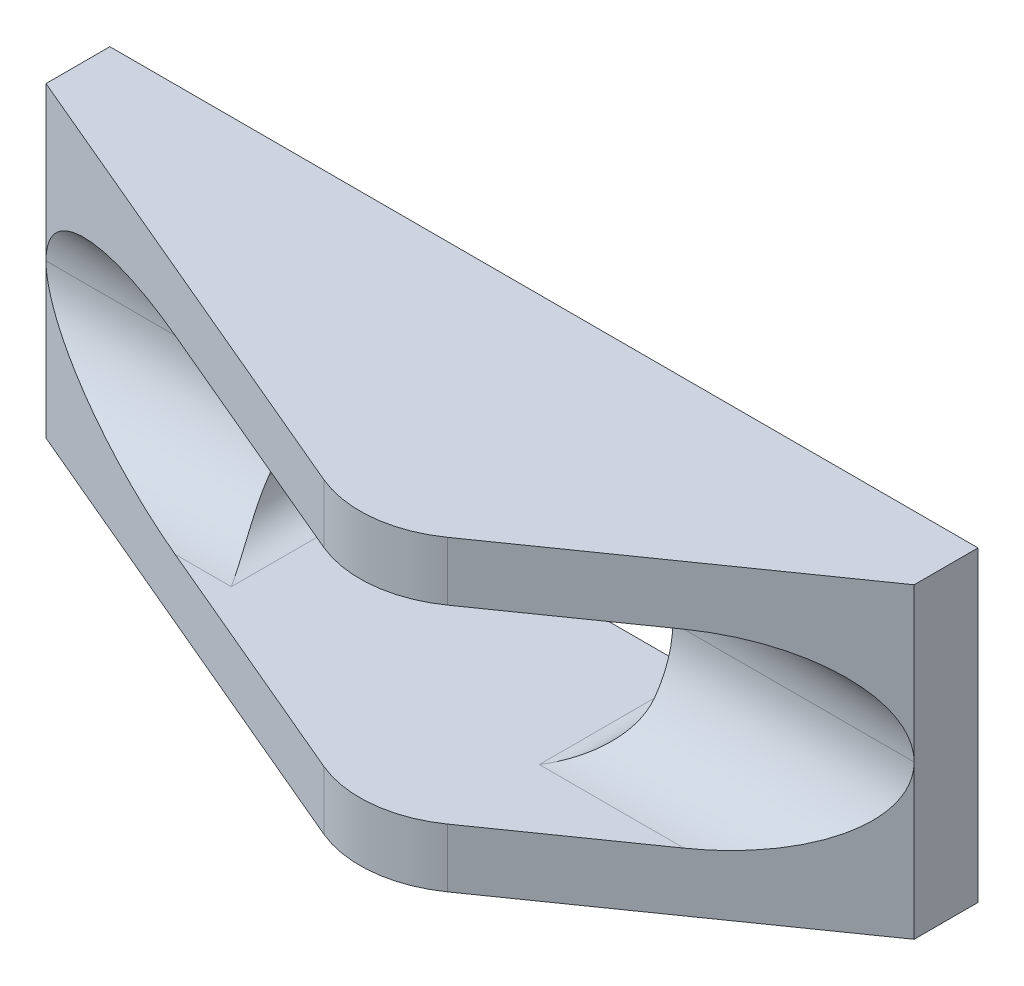
from build123d import *

# Parameters (mm, degrees)
SKETCH1_W           = 56.9849
SKETCH1_H           = 4.191
BOSS_EXTRUDE2_DEPTH = 10.07745
CUT_EXTRUDE2_DEPTH  = 6.223
FILLET8_R           = 6.223
CUT_EXTRUDE5_DEPTH  = 37.991848321


with BuildPart() as part:
    # Sketch1 → Boss-Extrude2 (new, symmetric)
    with BuildSketch(Plane(origin=(0, 0, 0), x_dir=(1, 0, 0), z_dir=(0, 1, 0))):
        with Locations((2.101827362, 14.315884605)):
            Rectangle(SKETCH1_W, SKETCH1_H)
        with BuildLine():
            Line((-26.390622638, 12.220384605), (5.236321347, -1.174073262))
            ThreePointArc((5.236321347, -1.174073262), (9.008282942, -1.735261042), (12.579803169, -0.398522749))
            Line((12.579803169, -0.398522749), (30.594277362, 12.220384605))
            Line((30.594277362, 12.220384605), (-26.390622638, 12.220384605))
        make_face()
    extrude(amount=BOSS_EXTRUDE2_DEPTH, both=True)

    # Sketch1<16> → Cut-Extrude2 (cut, symmetric)
    with BuildSketch(Plane(origin=(0, 0, 0), x_dir=(1, 0, 0), z_dir=(0, 1, 0))):
        with BuildLine():
            Line((-26.390622638, 12.220384605), (5.236321347, -1.174073262))
            ThreePointArc((5.236321347, -1.174073262), (9.008282942, -1.735261042), (12.579803169, -0.398522749))
            Line((12.579803169, -0.398522749), (30.594277362, 12.220384605))
            Line((30.594277362, 12.220384605), (-26.390622638, 12.220384605))
        make_face()
    extrude(amount=CUT_EXTRUDE2_DEPTH, both=True, mode=Mode.SUBTRACT)

    # Fillet8
    fillet8_edges = [part.edges().sort_by_distance(p)[0] for p in [
        (2.101827362, 6.223, -12.220384605),
        (2.101827362, -6.223, -12.220384605),
    ]]
    fillet(fillet8_edges, radius=FILLET8_R - 0.0001)  # a hair under: the kernel refuses the full size

    # Sketch3 → Cut-Extrude5 (cut, through all)
    with BuildSketch(Plane(origin=(0, 0, -16.411384605), x_dir=(-1, 0, 0), z_dir=(0, 0, -1))):
        with BuildLine():
            Line((-12.211027362, -6.223), (8.007372638, -6.223))
            ThreePointArc((8.007372638, -6.223), (9.803423862, -5.479051224), (10.547372638, -3.683))
            Line((10.547372638, -3.683), (10.547372638, 3.683))
            ThreePointArc((10.547372638, 3.683), (9.803423862, 5.479051224), (8.007372638, 6.223))
            Line((8.007372638, 6.223), (-12.211027362, 6.223))
            ThreePointArc((-12.211027362, 6.223), (-14.007078586, 5.479051224), (-14.751027362, 3.683))
            Line((-14.751027362, 3.683), (-14.751027362, -3.683))
            ThreePointArc((-14.751027362, -3.683), (-14.007078586, -5.479051224), (-12.211027362, -6.223))
        make_face()
    extrude(amount=-CUT_EXTRUDE5_DEPTH, mode=Mode.SUBTRACT)


solid = part.part
